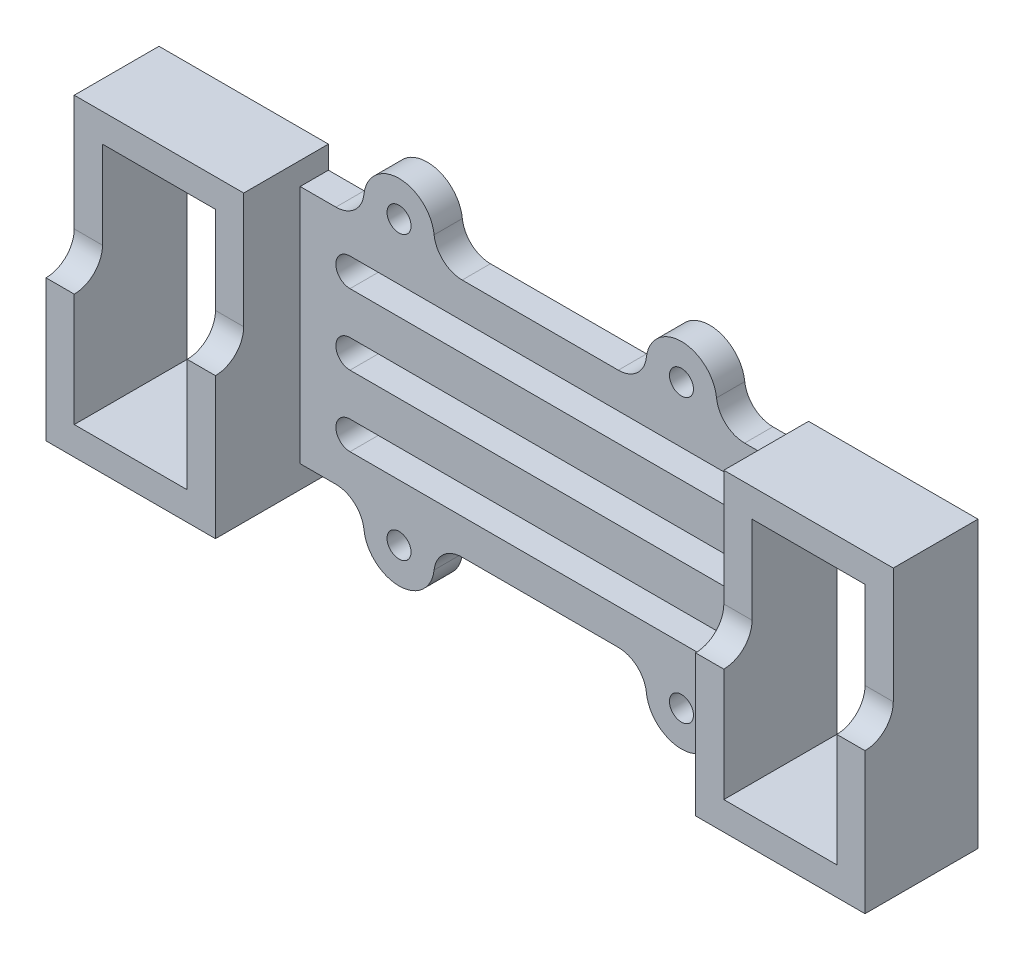
from build123d import *

# Parameters (mm, degrees)
SKETCH2_R           = 0.85
SKETCH2_W           = 8
SKETCH2_H           = 16.2
BOSS_EXTRUDE1_DEPTH = 2
SKETCH6_W           = 12
SKETCH6_H           = 20.2
SKETCH6_W_2         = 8
SKETCH6_H_2         = 16.2
BOSS_EXTRUDE5_DEPTH = 4
BOSS_EXTRUDE6_DEPTH = 2
FILLET1_R           = 2


with BuildPart() as part:
    # Sketch2 → Boss-Extrude1 (new body)
    with BuildSketch(Plane.XY):
        with BuildLine():
            Line((5.527864045, 8.5), (-5.527864045, 8.5))
            ThreePointArc((-5.527864045, 8.5), (-6.861197378, 9.009288015), (-7.515480025, 10.277777778))
            ThreePointArc((-7.515480025, 10.277777778), (-10, 12.5), (-12.484519975, 10.277777778))
            ThreePointArc((-12.484519975, 10.277777778), (-13.138802622, 9.009288015), (-14.472135955, 8.5))
            Line((-14.472135955, 8.5), (-17, 8.5))
            Line((-17, 8.5), (-17, 10.1))
            Line((-17, 10.1), (-29, 10.1))
            Line((-29, 10.1), (-29, 0))
            Line((-29, 0), (-29, -10.1))
            Line((-29, -10.1), (-17, -10.1))
            Line((-17, -10.1), (-17, -8.5))
            Line((-17, -8.5), (-14.472135955, -8.5))
            ThreePointArc((-14.472135955, -8.5), (-13.138802622, -9.009288015), (-12.484519975, -10.277777778))
            ThreePointArc((-12.484519975, -10.277777778), (-10, -12.5), (-7.515480025, -10.277777778))
            ThreePointArc((-7.515480025, -10.277777778), (-6.861197378, -9.009288015), (-5.527864045, -8.5))
            Line((-5.527864045, -8.5), (5.527864045, -8.5))
            ThreePointArc((5.527864045, -8.5), (6.861197378, -9.009288015), (7.515480025, -10.277777778))
            ThreePointArc((7.515480025, -10.277777778), (10, -12.5), (12.484519975, -10.277777778))
            ThreePointArc((12.484519975, -10.277777778), (13.138802622, -9.009288015), (14.472135955, -8.5))
            Line((14.472135955, -8.5), (17, -8.5))
            Line((17, -8.5), (17, -10.1))
            Line((17, -10.1), (29, -10.1))
            Line((29, -10.1), (29, 0))
            Line((29, 0), (29, 10.1))
            Line((29, 10.1), (17, 10.1))
            Line((17, 10.1), (17, 8.5))
            Line((17, 8.5), (14.472135955, 8.5))
            ThreePointArc((14.472135955, 8.5), (13.138802622, 9.009288015), (12.484519975, 10.277777778))
            ThreePointArc((12.484519975, 10.277777778), (10, 12.5), (7.515480025, 10.277777778))
            ThreePointArc((7.515480025, 10.277777778), (6.861197378, 9.009288015), (5.527864045, 8.5))
        make_face()
        with Locations((10, 10)):
            Circle(SKETCH2_R, mode=Mode.SUBTRACT)
        with Locations(Location((-10, 10, 0), (0, 0, 180))):
            Circle(SKETCH2_R, mode=Mode.SUBTRACT)
        with Locations((-10, -10)):
            Circle(SKETCH2_R, mode=Mode.SUBTRACT)
        with Locations(Location((10, -10, 0), (0, 0, 180))):
            Circle(SKETCH2_R, mode=Mode.SUBTRACT)
        with Locations((23, 0)):
            Rectangle(SKETCH2_W, SKETCH2_H, mode=Mode.SUBTRACT)
        with Locations((-23, 0)):
            Rectangle(SKETCH2_W, SKETCH2_H, mode=Mode.SUBTRACT)
        with BuildLine():
            Line((-13.472135955, 6), (13.472135955, 6))
            ThreePointArc((13.472135955, 6), (14.472135955, 5), (13.472135955, 4))
            Line((13.472135955, 4), (-13.472135955, 4))
            ThreePointArc((-13.472135955, 4), (-14.472135955, 5), (-13.472135955, 6))
        make_face(mode=Mode.SUBTRACT)
        with BuildLine():
            Line((13.472135955, -1), (-13.472135955, -1))
            ThreePointArc((-13.472135955, -1), (-14.472135955, 0), (-13.472135955, 1))
            Line((-13.472135955, 1), (13.472135955, 1))
            ThreePointArc((13.472135955, 1), (14.472135955, 0), (13.472135955, -1))
        make_face(mode=Mode.SUBTRACT)
        with BuildLine():
            Line((13.472135955, -6), (-13.472135955, -6))
            ThreePointArc((-13.472135955, -6), (-14.472135955, -5), (-13.472135955, -4))
            Line((-13.472135955, -4), (13.472135955, -4))
            ThreePointArc((13.472135955, -4), (14.472135955, -5), (13.472135955, -6))
        make_face(mode=Mode.SUBTRACT)
    extrude(amount=BOSS_EXTRUDE1_DEPTH)

    # Sketch6 → Boss-Extrude5 (add)
    # profile 1 of 2: a face of its own
    with BuildSketch(Plane.XY.offset(2)):
        with Locations((-23, 0)):
            Rectangle(SKETCH6_W, SKETCH6_H)
        with Locations((-23, 0)):
            Rectangle(SKETCH6_W_2, SKETCH6_H_2, mode=Mode.SUBTRACT)
    # profile 2 of 2: a face of its own
    with BuildSketch(Plane.XY.offset(2)):
        with Locations((23, 0)):
            Rectangle(SKETCH6_W, SKETCH6_H)
        with Locations((23, 0)):
            Rectangle(SKETCH6_W_2, SKETCH6_H_2, mode=Mode.SUBTRACT)
    extrude(amount=BOSS_EXTRUDE5_DEPTH)

    # Sketch7 → Boss-Extrude6 (add)
    with BuildSketch(Plane.XY.offset(6)):
        Polygon((17, -0.1), (19, -0.1), (19, -8.1), (27, -8.1), (27, -0.1), (29, -0.1), (29, -10.1), (17, -10.1), align=None)
        Polygon((-17, -10.1), (-17, -0.1), (-19, -0.1), (-19, -8.1), (-27, -8.1), (-27, -0.1), (-29, -0.1), (-29, -10.1), align=None)
    extrude(amount=BOSS_EXTRUDE6_DEPTH)

    # Fillet1
    fillet1_edges = [part.edges().sort_by_distance(p)[0] for p in [
        (28, -0.1, 6),
        (18, -0.1, 6),
        (-18, -0.1, 6),
        (-28, -0.1, 6),
    ]]
    fillet(fillet1_edges, radius=FILLET1_R - 0.0001)  # a hair under: the kernel refuses the full size


solid = part.part
